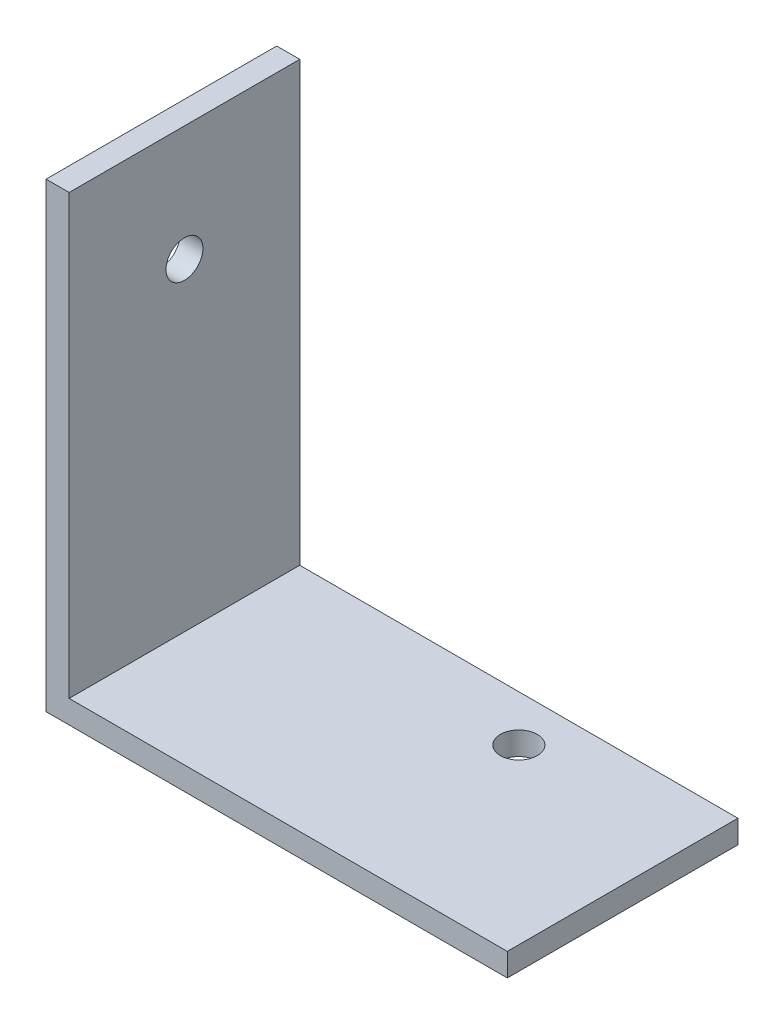
from build123d import *

# Parameters (mm, degrees)
EXTRUDE_1_DEPTH     = 20
SKETCH_2_R          = 1.6
CUT_EXTRUDE_1_DEPTH = 61
SKETCH_3_R          = 1.6
CUT_EXTRUDE_2_DEPTH = 61


with BuildPart() as part:
    # Эскиз1 → Бобышка-Вытянуть1 (new body)
    with BuildSketch(Plane.XY):
        Polygon((0, 0), (40, 0), (40, 2), (2, 2), (2, 40), (0, 40), align=None)
    extrude(amount=EXTRUDE_1_DEPTH)

    # Эскиз2 → Вырез-Вытянуть1 (cut, through all)
    with BuildSketch(Plane.XZ):
        with Locations((25, 4)):
            Circle(SKETCH_2_R)
    extrude(amount=-CUT_EXTRUDE_1_DEPTH, mode=Mode.SUBTRACT)

    # Эскиз3 → Вырез-Вытянуть2 (cut, through all)
    with BuildSketch(Plane.ZY):
        with Locations((10, 30)):
            Circle(SKETCH_3_R)
    extrude(amount=-CUT_EXTRUDE_2_DEPTH, mode=Mode.SUBTRACT)


solid = part.part
